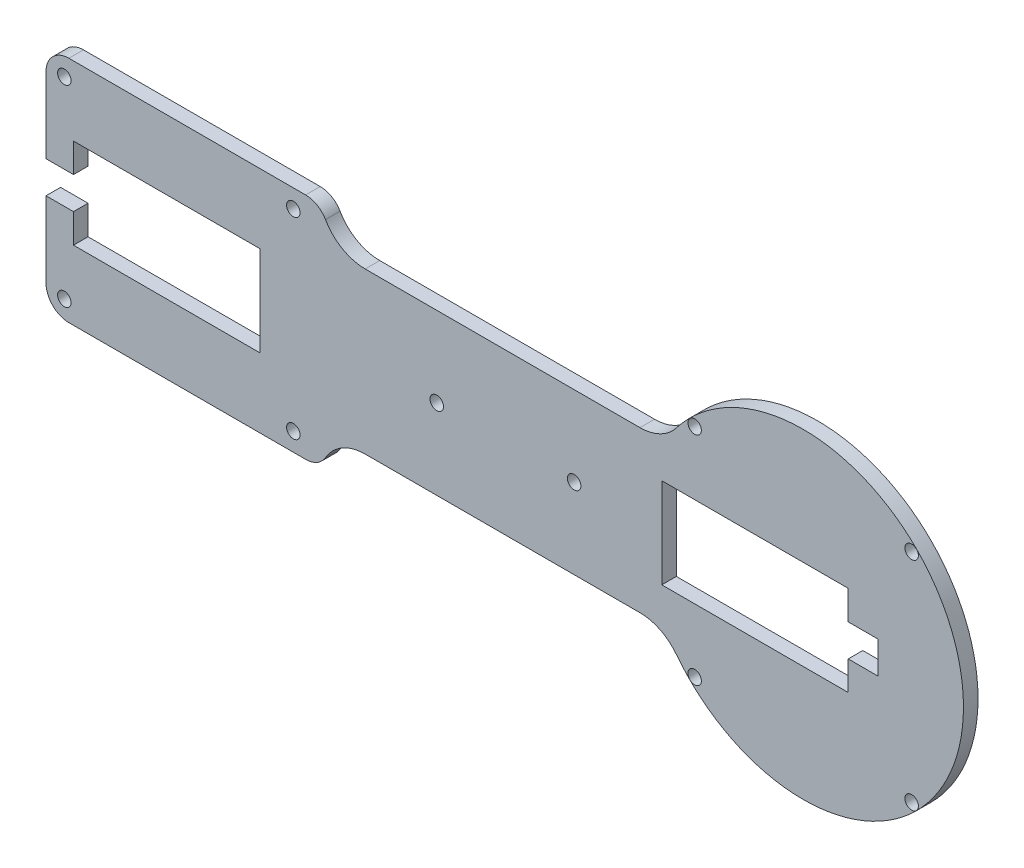
from build123d import *

# Parameters (mm, degrees)
BOSS_EXTRUDE1_DEPTH = 3.18
FILLET1_R           = 10
SKETCH2_W           = 3.18
SKETCH2_H           = 50
BOSS_EXTRUDE2_DEPTH = 60
FILLET3_R           = 10
FILLET4_R           = 5
SKETCH3_W           = 40.7
SKETCH3_H           = 19.69
CUT_EXTRUDE1_DEPTH  = 170.005332655
SKETCH4_W           = 40.7
SKETCH4_H           = 19.69
CUT_EXTRUDE2_DEPTH  = 3.18
SKETCH5_R           = 1.47
CUT_EXTRUDE3_DEPTH  = 3.18
CIRPATTERN1_COUNT   = 4
SKETCH6_R           = 1.47
CUT_EXTRUDE4_DEPTH  = 3.18
SKETCH8_R           = 1.47
CUT_EXTRUDE6_DEPTH  = 3.18
SKETCH10_W          = 6.5
SKETCH10_H          = 7
CUT_EXTRUDE8_DEPTH  = 3.18
SKETCH11_W          = 6.5
SKETCH11_H          = 7
CUT_EXTRUDE9_DEPTH  = 3.18


with BuildPart() as part:
    # Sketch1 → Boss-Extrude1 (new body)
    with BuildSketch(Plane.XY):
        with BuildLine():
            Line((-105.310889132, 17.5), (-30.310889132, 17.5))
            ThreePointArc((-30.310889132, 17.5), (35, 0), (-30.310889132, -17.5))
            Line((-30.310889132, -17.5), (-105.310889132, -17.5))
            Line((-105.310889132, -17.5), (-105.310889132, 17.5))
        make_face()
    extrude(amount=BOSS_EXTRUDE1_DEPTH)

    # Fillet1
    fillet1_edges = [part.edges().sort_by_distance(p)[0] for p in [
        (-30.310889132, -17.5, 1.59),
        (-30.310889132, 17.5, 1.59),
    ]]
    fillet(fillet1_edges, radius=FILLET1_R)

    # Sketch2 → Boss-Extrude2 (add)
    with BuildSketch(Plane.ZY.offset(105.310889132)):
        with Locations((1.59, 0)):
            Rectangle(SKETCH2_W, SKETCH2_H)
    extrude(amount=BOSS_EXTRUDE2_DEPTH)

    # Fillet3
    # the kernel refuses this fillet: 10 mm, written as the material it adds along each edge
    with BuildSketch(Plane(origin=(-105.310889132, -17.5, 0), x_dir=(0, -1, 0), z_dir=(0, 0, 1))) as fillet3_piece_1:
        with BuildLine():
            CenterArc((10, 9.682458366), FILLET3_R, 180, 75.522487814)
            Line((0, 9.682458366), (-0.2, 9.682458366))
            Line((-0.2, 9.682458366), (-0.2, 0))
            Line((-0.2, 0), (0, -0.2))
            ThreePointArc((0, -0.2), (3.75, -0.2), (7.45, -0.193649167))
            Line((7.45, -0.193649167), (7.5, 0))
        make_face()
    extrude(amount=3.18)
    with BuildSketch(Plane(origin=(-105.310889132, 17.5, 0), x_dir=(0, 1, 0), z_dir=(0, 0, 1))) as fillet3_piece_2:
        with BuildLine():
            CenterArc((10, -9.682458366), FILLET3_R, 104.477512186, 75.522487814)
            Line((0, -9.682458366), (-0.2, -9.682458366))
            Line((-0.2, -9.682458366), (-0.2, 0))
            Line((-0.2, 0), (0, 0.2))
            ThreePointArc((0, 0.2), (3.75, 0.2), (7.45, 0.193649167))
            Line((7.45, 0.193649167), (7.5, 0))
        make_face()
    extrude(amount=3.18)

    # Fillet4
    fillet4_edges = [part.edges().sort_by_distance(p)[0] for p in [
        (-105.310889132, -25, 1.59),
        (-105.310889132, 25, 1.59),
        (-165.310889132, -25, 1.59),
        (-165.310889132, 25, 1.59),
    ]]
    fillet(fillet4_edges, radius=FILLET4_R)

    # Sketch3 → Cut-Extrude1 (cut, through all)
    with BuildSketch(Plane(origin=(0, 0, 0), x_dir=(-1, 0, 0), z_dir=(0, 0, -1))):
        with Locations((10.510889132, 0)):
            Rectangle(SKETCH3_W, SKETCH3_H)
    extrude(amount=-CUT_EXTRUDE1_DEPTH, mode=Mode.SUBTRACT)

    # Sketch4 → Cut-Extrude2 (cut)
    with BuildSketch(Plane(origin=(0, 0, 0), x_dir=(-1, 0, 0), z_dir=(0, 0, -1))):
        with Locations((138.960889132, 0)):
            Rectangle(SKETCH4_W, SKETCH4_H)
    extrude(amount=-CUT_EXTRUDE2_DEPTH, mode=Mode.SUBTRACT)

    # Sketch5 → Cut-Extrude3 (cut)
    with BuildSketch(Plane(origin=(0, 0, 0), x_dir=(-1, 0, 0), z_dir=(0, 0, -1))):
        with Locations((23.68807717, 23.68807717)):
            Circle(SKETCH5_R)
    cut_extrude3 = extrude(amount=-CUT_EXTRUDE3_DEPTH, mode=Mode.SUBTRACT)

    # CirPattern1: Cut-Extrude3 ×4 about axis
    cirpattern1_axis = Axis((0, 0, 0), (0, 0, 1))
    for i in range(1, CIRPATTERN1_COUNT):
        add(cut_extrude3.rotate(cirpattern1_axis, i * 360 / CIRPATTERN1_COUNT), mode=Mode.SUBTRACT)

    # Sketch6 → Cut-Extrude4 (cut)
    with BuildSketch(Plane(origin=(0, 0, 0), x_dir=(-1, 0, 0), z_dir=(0, 0, -1))):
        with Locations((161.310889132, -21)):
            Circle(SKETCH6_R)
        with Locations((111.310889132, -21)):
            Circle(SKETCH6_R)
    cut_extrude4 = extrude(amount=-CUT_EXTRUDE4_DEPTH, mode=Mode.SUBTRACT)

    # Mirror1: Cut-Extrude4 across plane
    add(cut_extrude4.mirror(Plane.ZX), mode=Mode.SUBTRACT)

    # Sketch8 → Cut-Extrude6 (cut)
    with BuildSketch(Plane(origin=(0, 0, 0), x_dir=(-1, 0, 0), z_dir=(0, 0, -1))):
        with Locations((80, 0)):
            Circle(SKETCH8_R)
        with Locations((50, 0)):
            Circle(SKETCH8_R)
    extrude(amount=-CUT_EXTRUDE6_DEPTH, mode=Mode.SUBTRACT)

    # Sketch10 → Cut-Extrude8 (cut)
    with BuildSketch(Plane(origin=(0, 0, 0), x_dir=(-1, 0, 0), z_dir=(0, 0, -1))):
        with Locations((162.560889132, 0)):
            Rectangle(SKETCH10_W, SKETCH10_H)
    extrude(amount=-CUT_EXTRUDE8_DEPTH, mode=Mode.SUBTRACT)

    # Sketch11 → Cut-Extrude9 (cut)
    with BuildSketch(Plane(origin=(0, 0, 0), x_dir=(-1, 0, 0), z_dir=(0, 0, -1))):
        with Locations((-13.089110868, 0)):
            Rectangle(SKETCH11_W, SKETCH11_H)
    extrude(amount=-CUT_EXTRUDE9_DEPTH, mode=Mode.SUBTRACT)


solid = part.part
